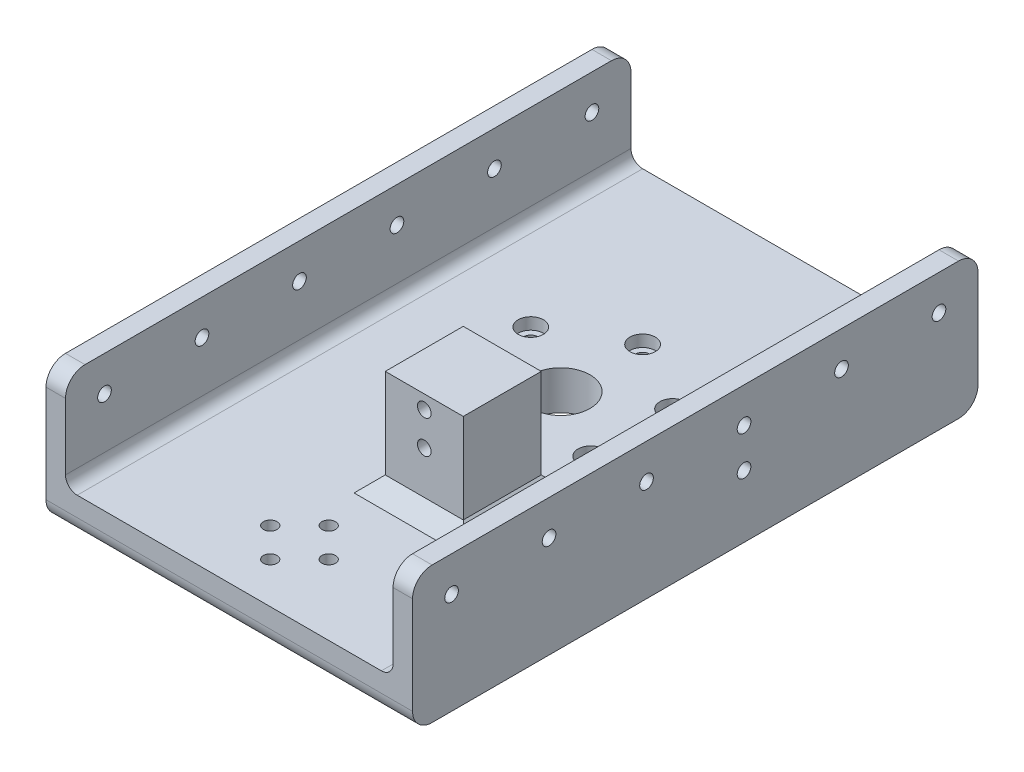
from build123d import *

# Parameters (mm, degrees)
BOSS_EXTRUDE1_DEPTH            = 85
BOSS_EXTRUDE1_DEPTH_BACK       = 60
SKETCH4_R                      = 7.5
CUT_EXTRUDE1_DEPTH             = 80
CBORE_FOR_M3_SHCS1_D           = 3.5
CBORE_FOR_M3_SHCS1_CBORE_D     = 6.5
CBORE_FOR_M3_SHCS1_CBORE_DEPTH = 3
CIRPATTERN1_COUNT              = 6
SKETCH5_R                      = 1.75
CUT_EXTRUDE2_DEPTH             = 132.476233594
LPATTERN1_COUNT                = 6
LPATTERN1_PITCH                = 25
SKETCH6_R                      = 1.75
CUT_EXTRUDE3_DEPTH             = 101.294566154
FILLET1_R                      = 5
FILLET2_R                      = 3
SKETCH9_R                      = 1.75
CUT_EXTRUDE6_DEPTH             = 10
SKETCH10_R                     = 3
CUT_EXTRUDE7_DEPTH             = 1.5
SKETCH11_W                     = 20
SKETCH11_H                     = 20
BOSS_EXTRUDE2_DEPTH            = 27
SKETCH12_R                     = 1.75
CUT_EXTRUDE8_DEPTH             = 104.937481209
CHAMFER1_SIZE                  = 4


with BuildPart() as part:
    # Sketch1 → Boss-Extrude1 (new, two sides: drawn at the far end of the back side and taken through both)
    with BuildSketch(Plane.XY.offset(-BOSS_EXTRUDE1_DEPTH_BACK)):
        Polygon((-47, 35), (-47, 0), (47, 0), (47, 35), (42, 35), (42, 10), (-42, 10), (-42, 35), align=None)
    extrude(amount=BOSS_EXTRUDE1_DEPTH + BOSS_EXTRUDE1_DEPTH_BACK)

    # Sketch4 → Cut-Extrude1 (cut)
    with BuildSketch(Plane(origin=(0, 10, 0), x_dir=(1, 0, 0), z_dir=(0, 1, 0))):
        with Locations(Location((0, 0, 0), (0, 0, 270))):
            Circle(SKETCH4_R)
    extrude(amount=-CUT_EXTRUDE1_DEPTH, mode=Mode.SUBTRACT)

    # CBORE for M3 SHCS1 (through all)
    with Locations(Plane(origin=(0, 10, 0), x_dir=(1, 0, 0), z_dir=(0, 1, 0))):
        with Locations((0, 21)):
            cbore_for_m3_shcs1 = CounterBoreHole(CBORE_FOR_M3_SHCS1_D / 2, CBORE_FOR_M3_SHCS1_CBORE_D / 2, CBORE_FOR_M3_SHCS1_CBORE_DEPTH)

    # CirPattern1: CBORE for M3 SHCS1 ×6 about axis
    cirpattern1_axis = Axis((0, 0, 0), (0, 1, 0))
    for i in range(1, CIRPATTERN1_COUNT):
        add(cbore_for_m3_shcs1.rotate(cirpattern1_axis, i * 360 / CIRPATTERN1_COUNT), mode=Mode.SUBTRACT)

    # Sketch5 → Cut-Extrude2 (cut, through all)
    with BuildSketch(Plane.ZY.offset(47)):
        with Locations(Location((-50, 26, 0), (0, 0, 270))):
            Circle(SKETCH5_R)
    cut_extrude2 = extrude(amount=-CUT_EXTRUDE2_DEPTH, mode=Mode.SUBTRACT)

    # LPattern1: Cut-Extrude2 ×6
    with Locations(*[(0, 0, i * LPATTERN1_PITCH) for i in range(1, LPATTERN1_COUNT)]):
        add(cut_extrude2, mode=Mode.SUBTRACT)

    # Sketch6 → Cut-Extrude3 (cut, through all)
    with BuildSketch(Plane(origin=(0, 10, 0), x_dir=(1, 0, 0), z_dir=(0, 1, 0))):
        with Locations(Location((0, -59.5, 0), (0, 0, 270))):
            Circle(SKETCH6_R)
        with Locations(Location((7.5, -67, 0), (0, 0, 270))):
            Circle(SKETCH6_R)
        with Locations(Location((0, -74.5, 0), (0, 0, 270))):
            Circle(SKETCH6_R)
        with Locations(Location((-7.5, -67, 0), (0, 0, 270))):
            Circle(SKETCH6_R)
    extrude(amount=-CUT_EXTRUDE3_DEPTH, mode=Mode.SUBTRACT)

    # Fillet1
    fillet1_edges = [part.edges().sort_by_distance(p)[0] for p in [
        (0, 0, -60),
        (44.5, 35, -60),
        (-44.5, 35, 85),
        (0, 0, 85),
        (44.5, 35, 85),
        (-44.5, 35, -60),
    ]]
    fillet(fillet1_edges, radius=FILLET1_R)

    # Fillet2
    fillet2_edges = [part.edges().sort_by_distance(p)[0] for p in [
        (-42, 10, 12.5),
        (42, 10, 12.5),
    ]]
    fillet(fillet2_edges, radius=FILLET2_R)

    # Sketch9 → Cut-Extrude6 (cut)
    with BuildSketch(Plane(origin=(47, 0, 0), x_dir=(0, 0, -1), z_dir=(1, 0, 0))):
        with Locations(Location((0, 16, 0), (0, 0, 90))):
            Circle(SKETCH9_R)
    extrude(amount=-CUT_EXTRUDE6_DEPTH, mode=Mode.SUBTRACT)

    # Sketch10 → Cut-Extrude7 (cut)
    with BuildSketch(Plane.ZY.offset(-42)):
        with Locations((0, 16)):
            Circle(SKETCH10_R)
    extrude(amount=-CUT_EXTRUDE7_DEPTH, mode=Mode.SUBTRACT)

    # Sketch11 → Boss-Extrude2 (add)
    with BuildSketch(Plane(origin=(0, 10, 0), x_dir=(1, 0, 0), z_dir=(0, 1, 0))):
        with Locations((10, -35)):
            Rectangle(SKETCH11_W, SKETCH11_H)
    extrude(amount=BOSS_EXTRUDE2_DEPTH)

    # Sketch12 → Cut-Extrude8 (cut, through all)
    with BuildSketch(Plane.XY):
        with Locations(Location((10, 25, 0), (0, 0, 180))):
            Circle(SKETCH12_R)
        with Locations(Location((10, 33.5, 0), (0, 0, 180))):
            Circle(SKETCH12_R)
    extrude(amount=CUT_EXTRUDE8_DEPTH, mode=Mode.SUBTRACT)

    # Chamfer1
    # the kernel refuses this chamfer: 4 mm, written as the material it adds along each edge
    with BuildSketch(Plane(origin=(0, 10, 45), x_dir=(0, -0.02749587661058651, 0.9996219169112968), z_dir=(1, 0, 0)), Plane(origin=(20, 10, 45), x_dir=(0.9996219169112968, -0.027495876610586487, 0), z_dir=(0, 0, -1)), Plane(origin=(0, 10, 25), x_dir=(-0.9996219169112968, -0.02749587661058648, 0), z_dir=(0, 0, 1))) as chamfer1_piece_1:
        Polygon((CHAMFER1_SIZE * 0.999621916911, -CHAMFER1_SIZE * 0.0274958766106), (-CHAMFER1_SIZE * 0.0274958766106, -CHAMFER1_SIZE * 0.999621916911), (0, 0), align=None)
    extrude(amount=20)
    with BuildSketch(Plane(origin=(20, 10, 25), x_dir=(0, -0.027495876610586487, -0.9996219169112968), z_dir=(-1, 0, 0))) as chamfer1_piece_2_section:
        Polygon((CHAMFER1_SIZE * 0.999621916911, -CHAMFER1_SIZE * 0.0274958766106), (-CHAMFER1_SIZE * 0.0274958766106, -CHAMFER1_SIZE * 0.999621916911), (0, 0), align=None)
    chamfer1_piece_2 = extrude(amount=20, mode=Mode.PRIVATE)
    chamfer1_piece_2 = chamfer1_piece_2 - Plane(origin=(0, 11.352573601, 21), x_dir=(-1, 0, 0), z_dir=(0, 1, 0)) * Cylinder(3.25, 56, mode=Mode.PRIVATE)
    add(chamfer1_piece_2)
    with BuildSketch(Plane(origin=(0, 10, 25), x_dir=(-0.9996219169112968, -0.02749587661058648, 0), z_dir=(0, 0, 1))) as chamfer1_piece_3a_section:
        Polygon((CHAMFER1_SIZE * 0.999621916911, -CHAMFER1_SIZE * 0.0274958766106), (-CHAMFER1_SIZE * 0.0274958766106, -CHAMFER1_SIZE * 0.999621916911), (0, 0), align=None)
    chamfer1_piece_3a = extrude(amount=30.286731952, mode=Mode.PRIVATE)
    chamfer1_piece_3a = split(chamfer1_piece_3a, bisect_by=Plane(origin=(-1.319174507, 11.319174507, 45), z_dir=(0, 0, 1)), keep=Keep.TOP, mode=Mode.PRIVATE)
    with BuildSketch(Plane(origin=(-10.286731952, 10, 45), x_dir=(0, -0.02749587661058651, 0.9996219169112968), z_dir=(1, 0, 0))) as chamfer1_piece_3b_section:
        Polygon((CHAMFER1_SIZE * 0.999621916911, -CHAMFER1_SIZE * 0.0274958766106), (-CHAMFER1_SIZE * 0.0274958766106, -CHAMFER1_SIZE * 0.999621916911), (0, 0), align=None)
    chamfer1_piece_3b = extrude(amount=30.286731952, mode=Mode.PRIVATE)
    chamfer1_piece_3b = split(chamfer1_piece_3b, bisect_by=Plane(origin=(0, 11.319174507, 46.319174507), z_dir=(-1, 0, 0)), keep=Keep.TOP, mode=Mode.PRIVATE)
    chamfer1_piece_3 = chamfer1_piece_3a & chamfer1_piece_3b
    add(chamfer1_piece_3)
    with BuildSketch(Plane(origin=(20, 10, 55.286731952), x_dir=(0.9996219169112968, -0.027495876610586487, 0), z_dir=(0, 0, -1))) as chamfer1_piece_4a_section:
        Polygon((CHAMFER1_SIZE * 0.999621916911, -CHAMFER1_SIZE * 0.0274958766106), (-CHAMFER1_SIZE * 0.0274958766106, -CHAMFER1_SIZE * 0.999621916911), (0, 0), align=None)
    chamfer1_piece_4a = extrude(amount=30.286731952, mode=Mode.PRIVATE)
    chamfer1_piece_4a = split(chamfer1_piece_4a, bisect_by=Plane(origin=(21.319174507, 11.319174507, 45), z_dir=(0, 0, 1)), keep=Keep.TOP, mode=Mode.PRIVATE)
    with BuildSketch(Plane(origin=(0, 10, 45), x_dir=(0, -0.02749587661058651, 0.9996219169112968), z_dir=(1, 0, 0))) as chamfer1_piece_4b_section:
        Polygon((CHAMFER1_SIZE * 0.999621916911, -CHAMFER1_SIZE * 0.0274958766106), (-CHAMFER1_SIZE * 0.0274958766106, -CHAMFER1_SIZE * 0.999621916911), (0, 0), align=None)
    chamfer1_piece_4b = extrude(amount=30.286731952, mode=Mode.PRIVATE)
    chamfer1_piece_4b = split(chamfer1_piece_4b, bisect_by=Plane(origin=(20, 11.319174507, 46.319174507), z_dir=(1, 0, 0)), keep=Keep.TOP, mode=Mode.PRIVATE)
    chamfer1_piece_4 = chamfer1_piece_4a & chamfer1_piece_4b
    add(chamfer1_piece_4)
    with BuildSketch(Plane(origin=(30.286731952, 10, 25), x_dir=(0, -0.027495876610586487, -0.9996219169112968), z_dir=(-1, 0, 0))) as chamfer1_piece_5a_section:
        Polygon((CHAMFER1_SIZE * 0.999621916911, -CHAMFER1_SIZE * 0.0274958766106), (-CHAMFER1_SIZE * 0.0274958766106, -CHAMFER1_SIZE * 0.999621916911), (0, 0), align=None)
    chamfer1_piece_5a = extrude(amount=30.286731952, mode=Mode.PRIVATE)
    chamfer1_piece_5a = split(chamfer1_piece_5a, bisect_by=Plane(origin=(20, 11.319174507, 23.680825493), z_dir=(1, 0, 0)), keep=Keep.TOP, mode=Mode.PRIVATE)
    with BuildSketch(Plane(origin=(20, 10, 45), x_dir=(0.9996219169112968, -0.027495876610586487, 0), z_dir=(0, 0, -1))) as chamfer1_piece_5b_section:
        Polygon((CHAMFER1_SIZE * 0.999621916911, -CHAMFER1_SIZE * 0.0274958766106), (-CHAMFER1_SIZE * 0.0274958766106, -CHAMFER1_SIZE * 0.999621916911), (0, 0), align=None)
    chamfer1_piece_5b = extrude(amount=30.286731952, mode=Mode.PRIVATE)
    chamfer1_piece_5b = split(chamfer1_piece_5b, bisect_by=Plane(origin=(21.319174507, 11.319174507, 25), z_dir=(0, 0, -1)), keep=Keep.TOP, mode=Mode.PRIVATE)
    chamfer1_piece_5 = chamfer1_piece_5a & chamfer1_piece_5b
    add(chamfer1_piece_5)
    with BuildSketch(Plane(origin=(0, 10, 14.713268048), x_dir=(-0.9996219169112968, -0.027495876610586494, 0), z_dir=(0, 0, 1))) as chamfer1_piece_6a_section:
        Polygon((CHAMFER1_SIZE * 0.999621916911, -CHAMFER1_SIZE * 0.0274958766106), (-CHAMFER1_SIZE * 0.0274958766106, -CHAMFER1_SIZE * 0.999621916911), (0, 0), align=None)
    chamfer1_piece_6a = extrude(amount=30.286731952, mode=Mode.PRIVATE)
    chamfer1_piece_6a = chamfer1_piece_6a - Plane(origin=(0, 10.566435826, 21), x_dir=(-1, 0, 0), z_dir=(0, 1, 0)) * Cylinder(3.25, 77, mode=Mode.PRIVATE)
    chamfer1_piece_6a = split(chamfer1_piece_6a, bisect_by=Plane(origin=(-3.383951939, 10.566435826, 25), z_dir=(0, 0, -1)), keep=Keep.TOP, mode=Mode.PRIVATE)
    with BuildSketch(Plane(origin=(20, 10, 25), x_dir=(0, -0.027495876610586487, -0.9996219169112968), z_dir=(-1, 0, 0))) as chamfer1_piece_6b_section:
        Polygon((CHAMFER1_SIZE * 0.999621916911, -CHAMFER1_SIZE * 0.0274958766106), (-CHAMFER1_SIZE * 0.0274958766106, -CHAMFER1_SIZE * 0.999621916911), (0, 0), align=None)
    chamfer1_piece_6b = extrude(amount=30.286731952, mode=Mode.PRIVATE)
    chamfer1_piece_6b = chamfer1_piece_6b - Plane(origin=(0, 11.389114273, 21), x_dir=(-1, 0, 0), z_dir=(0, 1, 0)) * Cylinder(3.25, 77, mode=Mode.PRIVATE)
    chamfer1_piece_6b = split(chamfer1_piece_6b, bisect_by=Plane(origin=(0, 11.389114273, 23.812991609), z_dir=(-1, 0, 0)), keep=Keep.TOP, mode=Mode.PRIVATE)
    chamfer1_piece_6 = chamfer1_piece_6a & chamfer1_piece_6b
    add(chamfer1_piece_6)


solid = part.part
